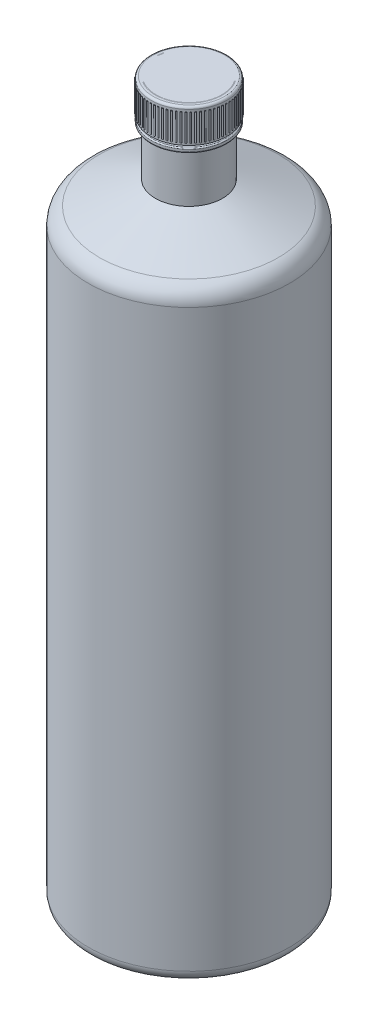
from build123d import *

# Parameters (mm, degrees)
BOSS_EXTRUDE1_START = -1
SKETCH3_R           = 0.3
BOSS_EXTRUDE1_DEPTH = 12
CIRPATTERN1_COUNT   = 69
FILLET1_R           = 1
BOSS_EXTRUDE2_START = 1
SKETCH4_R           = 17
SKETCH4_R_2         = 15.1
BOSS_EXTRUDE2_DEPTH = 2
FILLET2_R           = 0.5


with BuildPart() as part:
    # Sketch1 → Revolve-Thin1 (revolve)
    with BuildSketch(Plane.XY):
        with BuildLine():
            Line((0, 0), (40.000012172, 0))
            ThreePointArc((40.000012172, 0), (43.539444621, 1.46836894), (45, 5.011032824))
            Line((45, 5.011032824), (45, 262.076631232))
            ThreePointArc((45, 262.076631232), (43.635448985, 266.584165268), (40.000012172, 269.578069366))
            Line((40.000012172, 269.578069366), (15, 280))
            Line((15, 280), (15, 320))
            Line((15, 320), (14.7, 320))
            Line((14.7, 320), (14.7, 279.80003883))
            Line((14.7, 279.80003883), (39.884577927, 269.301166973))
            ThreePointArc((39.884577927, 269.301166973), (43.385818985, 266.417777579), (44.7, 262.076631232))
            Line((44.7, 262.076631232), (44.7, 5.010696719))
            ThreePointArc((44.7, 5.010696719), (43.327193756, 1.680382144), (40.000012172, 0.3))
            Line((40.000012172, 0.3), (0, 0.3))
            Line((0, 0.3), (0, 0))
        make_face()
    revolve(axis=Axis((0, 0, 0), (0, 1, 0)))


with BuildPart() as body_2:
    # Sketch2 → Revolve1 (revolve)
    with BuildSketch(Plane.XY):
        Polygon((17, 320), (17, 305), (15, 305), (15, 318), (0, 318), (0, 320), align=None)
    revolve(axis=Axis((0, 328.827025099, 0), (0, -1, 0)))

    # Sketch3 → Boss-Extrude1 (add)
    with BuildSketch(Plane.XZ.offset(-305).offset(BOSS_EXTRUDE1_START)):
        with Locations((0, 17)):
            Circle(SKETCH3_R)
    boss_extrude1 = extrude(amount=-BOSS_EXTRUDE1_DEPTH)

    # CirPattern1: Boss-Extrude1 ×69 about axis
    cirpattern1_axis = Axis((0, 328.827025099, 0), (0, 1, 0))
    for i in range(1, CIRPATTERN1_COUNT):
        add(boss_extrude1.rotate(cirpattern1_axis, i * 360 / CIRPATTERN1_COUNT))

    # Fillet1
    fillet1_edges = [body_2.edges().sort_by_distance(p)[0] for p in [
        (-17, 320, 0),
    ]]
    fillet(fillet1_edges, radius=FILLET1_R)


with BuildPart() as body_3:
    # Sketch4 → Boss-Extrude2 (new body)
    with BuildSketch(Plane.XZ.offset(-305).offset(BOSS_EXTRUDE2_START)):
        Circle(SKETCH4_R)
        Circle(SKETCH4_R_2, mode=Mode.SUBTRACT)
    extrude(amount=BOSS_EXTRUDE2_DEPTH)

    # Fillet2
    fillet2_edges = [body_3.edges().sort_by_distance(p)[0] for p in [
        (-17, 304, 0),
        (-17, 302, 0),
    ]]
    fillet(fillet2_edges, radius=FILLET2_R)


solid = Compound([part.part, body_2.part, body_3.part])
